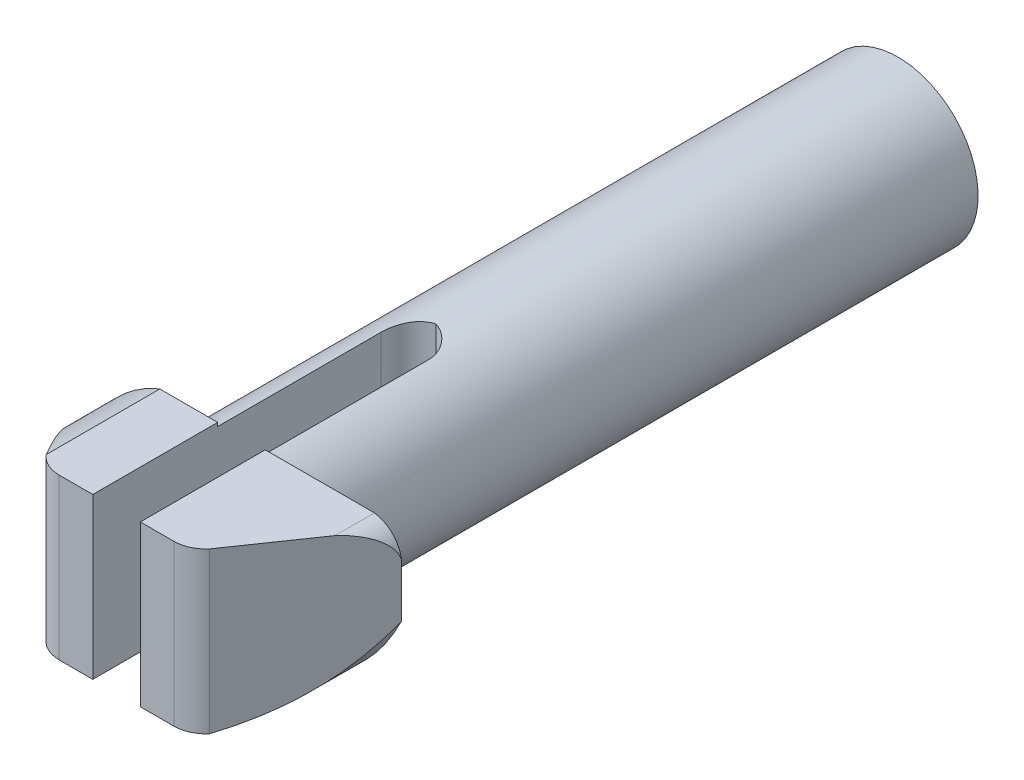
from build123d import *

# Parameters (mm, degrees)
BOSS_EXTRUDE1_DEPTH = 6.35
CUT_EXTRUDE3_DEPTH  = 4.953
SKETCH7_W           = 6.35
SKETCH7_H           = 6.35
CUT_EXTRUDE5_DEPTH  = 2.159
SKETCH9_R           = 3.175
BOSS_EXTRUDE4_DEPTH = 26.035
CUT_EXTRUDE6_REACH  = 34.945
SKETCH10_W          = 1.886216022
SKETCH10_H          = 12.7
FILLET1_R           = 1.27


with BuildPart() as part:
    # Sketch1 → Boss-Extrude1 (new body)
    with BuildSketch(Plane(origin=(0, 0, 0), x_dir=(1, 0, 0), z_dir=(0, 1, 0))):
        with BuildLine():
            Line((0.583306021, 0), (5.131693979, 0))
            ThreePointArc((5.131693979, 0), (5.661763503, 0.115908886), (6.095077487, 0.442478269))
            Line((6.095077487, 0.442478269), (9.2075, 4.953))
            Line((9.2075, 4.953), (6.0325, 4.953))
            Line((6.0325, 4.953), (6.0325, 7.112))
            Line((6.0325, 7.112), (-0.3175, 7.112))
            Line((-0.3175, 7.112), (-0.3175, 4.953))
            Line((-0.3175, 4.953), (-3.4925, 4.953))
            Line((-3.4925, 4.953), (-0.380077487, 0.442478269))
            ThreePointArc((-0.380077487, 0.442478269), (0.053236497, 0.115908886), (0.583306021, 0))
        make_face()
    extrude(amount=BOSS_EXTRUDE1_DEPTH)

    # Sketch5 → Cut-Extrude3 (cut)
    with BuildSketch(Plane.XY):
        with BuildLine():
            Line((-3.4925, 3.175), (-3.4925, 6.35))
            Line((-3.4925, 6.35), (-0.380077487, 6.35))
            add(Edge.make_bspline(
                [(-3.4925, 3.175), (-2.286021044, 5.595085513), (-0.380077487, 6.35)],
                knots=[0, 0, 0, 0.524463315, 0.524463315, 0.524463315], degree=2))
        make_face()
        with BuildLine():
            Line((6.095077487, 0), (9.2075, 0))
            Line((9.2075, 0), (9.2075, 3.175))
            add(Edge.make_bspline(
                [(9.2075, 3.175), (8.001021011, 0.754914499), (6.095077487, 0)],
                knots=[0, 0, 0, 0.524463308, 0.524463308, 0.524463308], degree=2))
        make_face()
        with BuildLine():
            Line((9.2075, 6.35), (9.2075, 5.2705))
            ThreePointArc((9.2075, 5.2705), (8.848057048, 5.990557048), (8.128, 6.35))
            Line((8.128, 6.35), (9.2075, 6.35))
        make_face()
        with BuildLine():
            Line((-3.4925, 0), (-2.413, 0))
            ThreePointArc((-2.413, 0), (-3.133057048, 0.359442952), (-3.4925, 1.0795))
            Line((-3.4925, 1.0795), (-3.4925, 0))
        make_face()
    extrude(amount=-CUT_EXTRUDE3_DEPTH, mode=Mode.SUBTRACT)

    # Sketch7 → Cut-Extrude5 (cut)
    with BuildSketch(Plane(origin=(0, 0, -7.112), x_dir=(-1, 0, 0), z_dir=(0, 0, -1))):
        with Locations((-2.8575, 3.175)):
            Rectangle(SKETCH7_W, SKETCH7_H)
    extrude(amount=-CUT_EXTRUDE5_DEPTH, mode=Mode.SUBTRACT)

    # Sketch9 → Boss-Extrude4 (add)
    with BuildSketch(Plane(origin=(0, 0, -4.953), x_dir=(-1, 0, 0), z_dir=(0, 0, -1))):
        with Locations(Location((-2.8575, 3.175, 0), (0, 0, 270))):
            Circle(SKETCH9_R)
    extrude(amount=BOSS_EXTRUDE4_DEPTH)

    # Cut-Extrude6: up to this face of the body (flat: up to its plane)
    cut_extrude6_end = Plane(part.part.faces().sort_by_distance((2.192673253, 0, -2.628972318))[0])
    # Sketch10 → Cut-Extrude6 (cut, up to the picked face)
    with BuildSketch(Plane(origin=(0, 6.35, 0), x_dir=(1, 0, 0), z_dir=(0, 1, 0)), mode=Mode.PRIVATE) as cut_extrude6_sk1:
        with Locations((2.8575, 6.35)):
            Rectangle(SKETCH10_W, SKETCH10_H)
    cut_extrude6_tool1 = split(extrude(cut_extrude6_sk1.sketch, amount=-CUT_EXTRUDE6_REACH, mode=Mode.PRIVATE), bisect_by=cut_extrude6_end, keep=Keep.BOTH, mode=Mode.PRIVATE)
    add(cut_extrude6_tool1.solids().sort_by(Axis((2.8575, 6.35, -6.35), (0, -1, 0)))[0], mode=Mode.SUBTRACT)

    # Fillet1
    # the kernel refuses this fillet: 1.27 mm, written as the material it adds along each edge
    with BuildSketch(Plane(origin=(1.914391989, 9.381694622, -12.7), x_dir=(1, 0, 0), z_dir=(0, -1, 0))) as fillet1_piece_1_section:
        with BuildLine():
            CenterArc((FILLET1_R, FILLET1_R), FILLET1_R, 180, 90)
            Line((0, FILLET1_R), (0, 0))
            Line((0, 0), (FILLET1_R, 0))
        make_face()
    fillet1_piece_1 = extrude(amount=12.413389243, mode=Mode.PRIVATE)
    fillet1_piece_1 = fillet1_piece_1 & Plane(origin=(2.8575, 3.175, -12.415110082), x_dir=(0, -1, 0), z_dir=(0, 0, 1)) * Cylinder(3.175, 30, mode=Mode.PRIVATE)
    add(fillet1_piece_1)
    with BuildSketch(Plane(origin=(3.800608011, 9.381694622, -12.7), x_dir=(0, 0, 1), z_dir=(0, -1, 0))) as fillet1_piece_2_section:
        with BuildLine():
            CenterArc((FILLET1_R, FILLET1_R), FILLET1_R, 180, 90)
            Line((0, FILLET1_R), (0, 0))
            Line((0, 0), (FILLET1_R, 0))
        make_face()
    fillet1_piece_2 = extrude(amount=12.413389243, mode=Mode.PRIVATE)
    fillet1_piece_2 = fillet1_piece_2 & Plane(origin=(2.8575, 3.175, -12.415110016), x_dir=(0, -1, 0), z_dir=(0, 0, 1)) * Cylinder(3.175, 30, mode=Mode.PRIVATE)
    add(fillet1_piece_2)


solid = part.part
